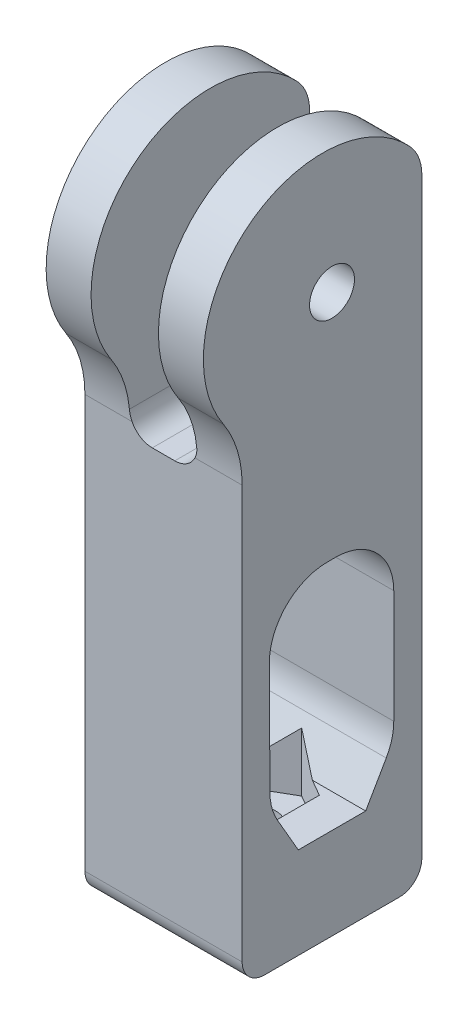
from build123d import *
from OCP.BRepFilletAPI import BRepFilletAPI_MakeChamfer

# Parameters (mm, degrees)
SKETCH9_R           = 2
BOSS_EXTRUDE3_DEPTH = 14
SKETCH10_R          = 2
CUT_EXTRUDE7_DEPTH  = 14
SKETCH11_W          = 6
SKETCH11_H          = 26.686138344
CUT_EXTRUDE8_DEPTH  = 28
FILLET1_R           = 2
CHAMFER1_SIZE       = 2.5
CHAMFER1_SIZE2      = 4.365846821
CHAMFER1_SIZE2_2    = 4.330127019
EXTRUDE1_DEPTH      = 3
EXTRUDE1_DEPTH_BACK = 3
FILLET2_R           = 2
FILLET3_R           = 5


with BuildPart() as part:
    # Sketch9 → Boss-Extrude3 (new body)
    with BuildSketch(Plane(origin=(0, 0, 0), x_dir=(0, 0, -1), z_dir=(1, 0, 0))):
        with BuildLine():
            Line((8, 5.053889445), (8, -49.642014822))
            Line((8, -49.642014822), (-8, -49.642014822))
            Line((-8, -49.642014822), (-8, -10.875806049))
            ThreePointArc((-8, -10.875806049), (-8.427714838, -7.982476346), (-9.674271354, -5.336650652))
            ThreePointArc((-9.674271354, -5.336650652), (-7.418447874, 8.870328147), (6.925281884, 7.78202542))
            ThreePointArc((6.925281884, 7.78202542), (7.721634556, 6.519985019), (8, 5.053889445))
        make_face()
        Circle(SKETCH9_R, mode=Mode.SUBTRACT)
        with BuildLine():
            Line((5.5, -41.5), (5.5, -25.762364524))
            ThreePointArc((5.5, -25.762364524), (3.987567872, -22.111030369), (0.336233717, -20.598598241))
            Line((0.336233717, -20.598598241), (-0.410415455, -20.598598241))
            ThreePointArc((-0.410415455, -20.598598241), (-4.070351606, -22.119652678), (-5.574124284, -25.786723302))
            Line((-5.574124284, -25.786723302), (-5.5, -41.5))
            Line((-5.5, -41.5), (5.5, -41.5))
        make_face(mode=Mode.SUBTRACT)
    extrude(amount=BOSS_EXTRUDE3_DEPTH)

    # Sketch10 → Cut-Extrude7 (cut)
    with BuildSketch(Plane.XZ.offset(49.642014822)):
        with Locations((7, 0)):
            Circle(SKETCH10_R)
    extrude(amount=-CUT_EXTRUDE7_DEPTH, mode=Mode.SUBTRACT)

    # Sketch11 → Cut-Extrude8 (cut)
    with BuildSketch(Plane(origin=(0, 16, 0), x_dir=(1, 0, 0), z_dir=(0, 1, 0))):
        with Locations((7, -2.737831409)):
            Rectangle(SKETCH11_W, SKETCH11_H)
    extrude(amount=-CUT_EXTRUDE8_DEPTH, mode=Mode.SUBTRACT)

    # Fillet1
    fillet1_edges = [part.edges().sort_by_distance(p)[0] for p in [
        (7, -49.642014822, -8),
        (7, -49.642014822, 8),
    ]]
    fillet(fillet1_edges, radius=FILLET1_R)

    # Chamfer1: one chamfer whose edges measure the first distance from different faces: ONE call of the kernel's chamfer builder (chamfer() names one face for all edges)
    chamfer1_edges_1 = [part.edges().sort_by_distance(p)[0] for p in [
        (7, -41.5, 5.5),
    ]]
    chamfer1_side_1 = [part.faces().sort_by_distance(p)[0] for p in [
        (7, -41.5, 5.321955062),
    ]]
    chamfer1_edges_2 = [part.edges().sort_by_distance(p)[0] for p in [
        (7, -41.5, -5.5),
    ]]
    chamfer1_side_2 = [part.faces().sort_by_distance(p)[0] for p in [
        (7, -41.5, 5.321955062),
    ]]
    chamfer1 = BRepFilletAPI_MakeChamfer(part.part.solid().wrapped)
    for e in chamfer1_edges_1:
        chamfer1.Add(CHAMFER1_SIZE, CHAMFER1_SIZE2, e.wrapped, chamfer1_side_1[0].wrapped)  # the first distance lies on this face
    for e in chamfer1_edges_2:
        chamfer1.Add(CHAMFER1_SIZE, CHAMFER1_SIZE2_2, e.wrapped, chamfer1_side_2[0].wrapped)  # the first distance lies on this face
    add(Compound.cast(chamfer1.Shape()), mode=Mode.REPLACE)

    # Sketch12 → Extrude1 (cut, two sides: drawn at the far end of the back side and taken through both)
    with BuildSketch(Plane(origin=(0, -41.5, 0), x_dir=(1, 0, 0), z_dir=(0, 1, 0)).offset(-EXTRUDE1_DEPTH_BACK)):
        Polygon((7, 4.3), (3.276090764, 2.15), (3.276090764, -2.15), (7, -4.3), (10.723909236, -2.15), (10.723909236, 2.15), align=None)
    extrude(amount=EXTRUDE1_DEPTH + EXTRUDE1_DEPTH_BACK, mode=Mode.SUBTRACT)

    # Fillet2
    fillet2_edges = [part.edges().sort_by_distance(p)[0] for p in [
        (4, -12, 0),
        (10, -12, 0),
    ]]
    fillet(fillet2_edges, radius=FILLET2_R)

    # Fillet3
    fillet3_edges = [part.edges().sort_by_distance(p)[0] for p in [
        (7, -37.169872981, -5.5),
        (7, -37.134201755, 5.520594792),
    ]]
    fillet(fillet3_edges, radius=FILLET3_R)


solid = part.part
